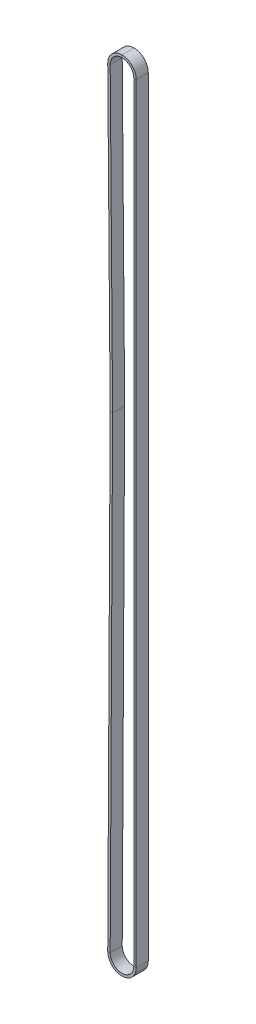
from build123d import *

# Parameters (mm, degrees)
SKETCH3_W = 7.366
SKETCH3_H = 1.5


with BuildPart() as part:
    # Sweep1: sweep along a path in Sketch2
    with BuildLine(Plane.XY) as sweep1_path:
        Line((-7.217959412, 0.037533359), (-5.727035895, 286.753819555))
        ThreePointArc((-5.727035895, 286.753819555), (-5.72700281, 286.7714882), (-5.727087308, 286.789156675))
        Line((-5.727087308, 286.789156675), (-7.217819637, 470.603463552))
        ThreePointArc((-7.217819637, 470.603463552), (-0.029268466, 477.879997624), (7.218056998, 470.662000003))
        Line((7.218056998, 470.662000003), (7.218056998, 0))
        ThreePointArc((7.218056998, 0), (-0.018766743, -7.218032601), (-7.217959412, 0.037533359))
    # Sketch3 → Sweep1 (sweep)
    with BuildSketch(Plane(origin=(0, 0, 0), x_dir=(0, 0, -1), z_dir=(1, 0, 0))):
        with Locations((3.683, 478.630056998)):
            Rectangle(SKETCH3_W, SKETCH3_H)
    sweep(path=sweep1_path.line)


solid = part.part
